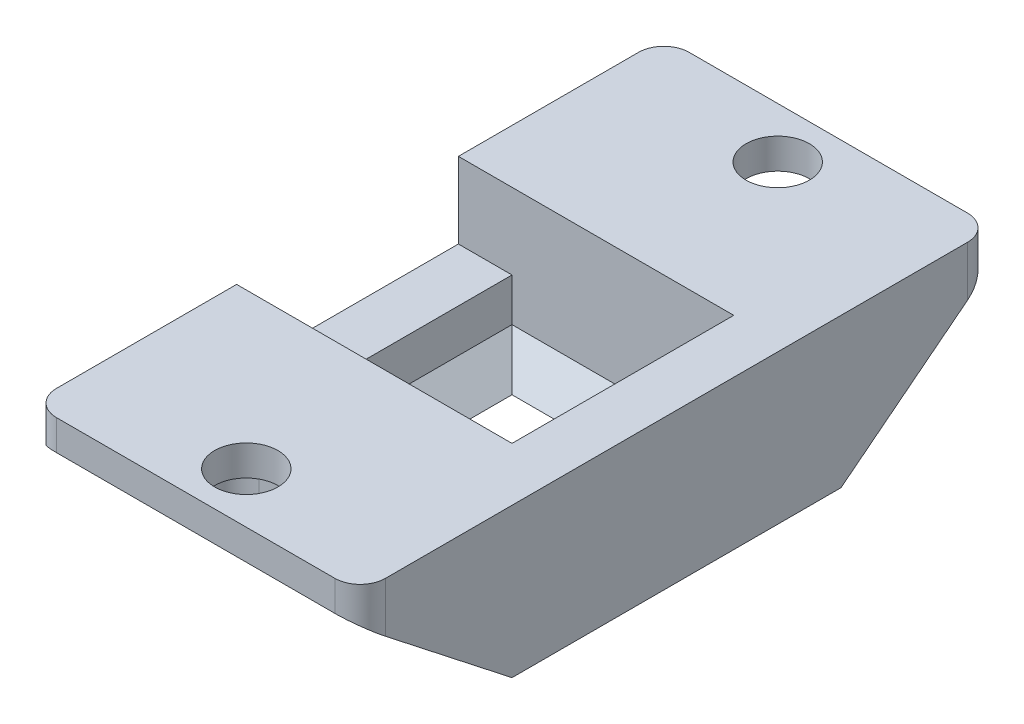
from build123d import *

# Parameters (mm, degrees)
SKETCH1_W           = 8.763
SKETCH1_H           = 8.763
SKETCH1_W_2         = 5.763
SKETCH1_H_2         = 5.763
BOSS_EXTRUDE1_DEPTH = 1.2
SKETCH2_W           = 13
SKETCH2_H           = 13
SKETCH2_W_2         = 8.763
SKETCH2_H_2         = 8.763
BOSS_EXTRUDE3_DEPTH = 5.9
CHAMFER1_SIZE       = 1.5
SKETCH3_W           = 13
SKETCH3_H           = 6
SKETCH3_R           = 1.25
BOSS_EXTRUDE4_DEPTH = 1.2
BOSS_EXTRUDE5_DEPTH = 2
FILLET1_R           = 1
CUT_EXTRUDE1_REACH  = 20.975
SKETCH4_W           = 8.763
SKETCH4_H           = 3


with BuildPart() as part:
    # Sketch1 → Boss-Extrude1 (new body)
    with BuildSketch(Plane(origin=(0, 0, 0), x_dir=(1, 0, 0), z_dir=(0, 1, 0))):
        Rectangle(SKETCH1_W, SKETCH1_H)
        Rectangle(SKETCH1_W_2, SKETCH1_H_2, mode=Mode.SUBTRACT)
    extrude(amount=BOSS_EXTRUDE1_DEPTH)

    # Sketch2 → Boss-Extrude3 (add)
    with BuildSketch(Plane.XZ):
        Rectangle(SKETCH2_W, SKETCH2_H)
        Rectangle(SKETCH2_W_2, SKETCH2_H_2, mode=Mode.SUBTRACT)
    extrude(amount=-BOSS_EXTRUDE3_DEPTH)

    # Chamfer1
    # the kernel refuses this chamfer: 1.5 mm, written as the material it takes off along each edge
    with BuildSketch(Plane(origin=(2.8815, 1.2, -2.8815), x_dir=(0, 0.02749587661058634, -0.9996219169112968), z_dir=(-1, 0, 0))) as chamfer1_piece_1_section:
        Polygon((CHAMFER1_SIZE * 0.999621916911, CHAMFER1_SIZE * 0.0274958766106), (-CHAMFER1_SIZE * 0.0274958766106, CHAMFER1_SIZE * 0.999621916911), (0, 0), align=None)
    chamfer1_piece_1 = extrude(amount=5.763, mode=Mode.PRIVATE)
    chamfer1_piece_1 = split(chamfer1_piece_1, bisect_by=Plane(origin=(0, 0.704393769, -4.3815), z_dir=(0, 0, 1)), keep=Keep.TOP, mode=Mode.PRIVATE)
    add(chamfer1_piece_1, mode=Mode.SUBTRACT)
    with BuildSketch(Plane(origin=(2.8815, 1.2, 2.8815), x_dir=(-0.02749587661058649, -0.9996219169112968, 0), z_dir=(0, 0, -1))) as chamfer1_piece_2_section:
        Polygon((CHAMFER1_SIZE * 0.999621916911, -CHAMFER1_SIZE * 0.0274958766106), (-CHAMFER1_SIZE * 0.0274958766106, -CHAMFER1_SIZE * 0.999621916911), (0, 0), align=None)
    chamfer1_piece_2 = extrude(amount=5.763, mode=Mode.PRIVATE)
    chamfer1_piece_2 = split(chamfer1_piece_2, bisect_by=Plane(origin=(4.3815, 0.704393769, 0), z_dir=(-1, 0, 0)), keep=Keep.TOP, mode=Mode.PRIVATE)
    add(chamfer1_piece_2, mode=Mode.SUBTRACT)
    with BuildSketch(Plane(origin=(-2.8815, 1.2, 2.8815), x_dir=(0, -0.9996219169112968, -0.02749587661058649), z_dir=(1, 0, 0))) as chamfer1_piece_3_section:
        Polygon((CHAMFER1_SIZE * 0.999621916911, -CHAMFER1_SIZE * 0.0274958766106), (-CHAMFER1_SIZE * 0.0274958766106, -CHAMFER1_SIZE * 0.999621916911), (0, 0), align=None)
    chamfer1_piece_3 = extrude(amount=5.763, mode=Mode.PRIVATE)
    chamfer1_piece_3 = split(chamfer1_piece_3, bisect_by=Plane(origin=(0, 0.704393769, 4.3815), z_dir=(0, 0, -1)), keep=Keep.TOP, mode=Mode.PRIVATE)
    add(chamfer1_piece_3, mode=Mode.SUBTRACT)
    with BuildSketch(Plane(origin=(-2.8815, 1.2, -2.8815), x_dir=(0.02749587661058649, -0.9996219169112968, 0), z_dir=(0, 0, 1))) as chamfer1_piece_4_section:
        Polygon((CHAMFER1_SIZE * 0.999621916911, -CHAMFER1_SIZE * 0.0274958766106), (-CHAMFER1_SIZE * 0.0274958766106, -CHAMFER1_SIZE * 0.999621916911), (0, 0), align=None)
    chamfer1_piece_4 = extrude(amount=5.763, mode=Mode.PRIVATE)
    chamfer1_piece_4 = split(chamfer1_piece_4, bisect_by=Plane(origin=(-4.3815, 0.704393769, 0), z_dir=(1, 0, 0)), keep=Keep.TOP, mode=Mode.PRIVATE)
    add(chamfer1_piece_4, mode=Mode.SUBTRACT)
    with BuildSketch(Plane(origin=(2.8815, 1.2, 2.8815), x_dir=(-0.02749587661058649, -0.9996219169112968, 0), z_dir=(0, 0, -1))) as chamfer1_piece_5a_section:
        Polygon((CHAMFER1_SIZE * 0.999621916911, -CHAMFER1_SIZE * 0.0274958766106), (-CHAMFER1_SIZE * 0.0274958766106, -CHAMFER1_SIZE * 0.999621916911), (0, 0), align=None)
    chamfer1_piece_5a = extrude(amount=9.620524482, mode=Mode.PRIVATE)
    chamfer1_piece_5a = split(chamfer1_piece_5a, bisect_by=Plane(origin=(3.374451501, 0.704393769, -2.8815), z_dir=(0, 0, -1)), keep=Keep.TOP, mode=Mode.PRIVATE)
    chamfer1_piece_5a = split(chamfer1_piece_5a, bisect_by=Plane(origin=(3.374451501, 0.704393769, -4.3815), z_dir=(0, 0, 1)), keep=Keep.TOP, mode=Mode.PRIVATE)
    chamfer1_piece_5a = split(chamfer1_piece_5a, bisect_by=Plane(origin=(4.3815, 0.704393769, -3.6315), z_dir=(-1, 0, 0)), keep=Keep.TOP, mode=Mode.PRIVATE)
    with BuildSketch(Plane(origin=(6.739024482, 1.2, -2.8815), x_dir=(0, 0.02749587661058634, -0.9996219169112968), z_dir=(-1, 0, 0))) as chamfer1_piece_5b_section:
        Polygon((CHAMFER1_SIZE * 0.999621916911, CHAMFER1_SIZE * 0.0274958766106), (-CHAMFER1_SIZE * 0.0274958766106, CHAMFER1_SIZE * 0.999621916911), (0, 0), align=None)
    chamfer1_piece_5b = extrude(amount=9.620524482, mode=Mode.PRIVATE)
    chamfer1_piece_5b = split(chamfer1_piece_5b, bisect_by=Plane(origin=(2.8815, 0.704393769, -3.374451501), z_dir=(1, 0, 0)), keep=Keep.TOP, mode=Mode.PRIVATE)
    chamfer1_piece_5b = split(chamfer1_piece_5b, bisect_by=Plane(origin=(3.6315, 0.704393769, -4.3815), z_dir=(0, 0, 1)), keep=Keep.TOP, mode=Mode.PRIVATE)
    chamfer1_piece_5b = split(chamfer1_piece_5b, bisect_by=Plane(origin=(4.3815, 0.704393769, -3.374451501), z_dir=(-1, 0, 0)), keep=Keep.TOP, mode=Mode.PRIVATE)
    chamfer1_piece_5 = chamfer1_piece_5a & chamfer1_piece_5b
    add(chamfer1_piece_5, mode=Mode.SUBTRACT)
    with BuildSketch(Plane(origin=(-2.8815, 1.2, -6.739024482), x_dir=(0.02749587661058649, -0.9996219169112968, 0), z_dir=(0, 0, 1))) as chamfer1_piece_6a_section:
        Polygon((CHAMFER1_SIZE * 0.999621916911, -CHAMFER1_SIZE * 0.0274958766106), (-CHAMFER1_SIZE * 0.0274958766106, -CHAMFER1_SIZE * 0.999621916911), (0, 0), align=None)
    chamfer1_piece_6a = extrude(amount=9.620524482, mode=Mode.PRIVATE)
    chamfer1_piece_6a = split(chamfer1_piece_6a, bisect_by=Plane(origin=(-3.374451501, 0.704393769, -2.8815), z_dir=(0, 0, -1)), keep=Keep.TOP, mode=Mode.PRIVATE)
    chamfer1_piece_6a = split(chamfer1_piece_6a, bisect_by=Plane(origin=(-3.374451501, 0.704393769, -4.3815), z_dir=(0, 0, 1)), keep=Keep.TOP, mode=Mode.PRIVATE)
    chamfer1_piece_6a = split(chamfer1_piece_6a, bisect_by=Plane(origin=(-4.3815, 0.704393769, -3.6315), z_dir=(1, 0, 0)), keep=Keep.TOP, mode=Mode.PRIVATE)
    with BuildSketch(Plane(origin=(2.8815, 1.2, -2.8815), x_dir=(0, 0.02749587661058634, -0.9996219169112968), z_dir=(-1, 0, 0))) as chamfer1_piece_6b_section:
        Polygon((CHAMFER1_SIZE * 0.999621916911, CHAMFER1_SIZE * 0.0274958766106), (-CHAMFER1_SIZE * 0.0274958766106, CHAMFER1_SIZE * 0.999621916911), (0, 0), align=None)
    chamfer1_piece_6b = extrude(amount=9.620524482, mode=Mode.PRIVATE)
    chamfer1_piece_6b = split(chamfer1_piece_6b, bisect_by=Plane(origin=(-2.8815, 0.704393769, -3.374451501), z_dir=(-1, 0, 0)), keep=Keep.TOP, mode=Mode.PRIVATE)
    chamfer1_piece_6b = split(chamfer1_piece_6b, bisect_by=Plane(origin=(-3.6315, 0.704393769, -4.3815), z_dir=(0, 0, 1)), keep=Keep.TOP, mode=Mode.PRIVATE)
    chamfer1_piece_6b = split(chamfer1_piece_6b, bisect_by=Plane(origin=(-4.3815, 0.704393769, -3.374451501), z_dir=(1, 0, 0)), keep=Keep.TOP, mode=Mode.PRIVATE)
    chamfer1_piece_6 = chamfer1_piece_6a & chamfer1_piece_6b
    add(chamfer1_piece_6, mode=Mode.SUBTRACT)
    with BuildSketch(Plane(origin=(-2.8815, 1.2, 2.8815), x_dir=(0, -0.9996219169112968, -0.02749587661058649), z_dir=(1, 0, 0))) as chamfer1_piece_7a_section:
        Polygon((CHAMFER1_SIZE * 0.999621916911, -CHAMFER1_SIZE * 0.0274958766106), (-CHAMFER1_SIZE * 0.0274958766106, -CHAMFER1_SIZE * 0.999621916911), (0, 0), align=None)
    chamfer1_piece_7a = extrude(amount=9.620524482, mode=Mode.PRIVATE)
    chamfer1_piece_7a = split(chamfer1_piece_7a, bisect_by=Plane(origin=(2.8815, 0.704393769, 3.374451501), z_dir=(1, 0, 0)), keep=Keep.TOP, mode=Mode.PRIVATE)
    chamfer1_piece_7a = split(chamfer1_piece_7a, bisect_by=Plane(origin=(4.3815, 0.704393769, 3.374451501), z_dir=(-1, 0, 0)), keep=Keep.TOP, mode=Mode.PRIVATE)
    chamfer1_piece_7a = split(chamfer1_piece_7a, bisect_by=Plane(origin=(3.6315, 0.704393769, 4.3815), z_dir=(0, 0, -1)), keep=Keep.TOP, mode=Mode.PRIVATE)
    with BuildSketch(Plane(origin=(2.8815, 1.2, 6.739024482), x_dir=(-0.02749587661058649, -0.9996219169112968, 0), z_dir=(0, 0, -1))) as chamfer1_piece_7b_section:
        Polygon((CHAMFER1_SIZE * 0.999621916911, -CHAMFER1_SIZE * 0.0274958766106), (-CHAMFER1_SIZE * 0.0274958766106, -CHAMFER1_SIZE * 0.999621916911), (0, 0), align=None)
    chamfer1_piece_7b = extrude(amount=9.620524482, mode=Mode.PRIVATE)
    chamfer1_piece_7b = split(chamfer1_piece_7b, bisect_by=Plane(origin=(3.374451501, 0.704393769, 2.8815), z_dir=(0, 0, 1)), keep=Keep.TOP, mode=Mode.PRIVATE)
    chamfer1_piece_7b = split(chamfer1_piece_7b, bisect_by=Plane(origin=(4.3815, 0.704393769, 3.6315), z_dir=(-1, 0, 0)), keep=Keep.TOP, mode=Mode.PRIVATE)
    chamfer1_piece_7b = split(chamfer1_piece_7b, bisect_by=Plane(origin=(3.374451501, 0.704393769, 4.3815), z_dir=(0, 0, -1)), keep=Keep.TOP, mode=Mode.PRIVATE)
    chamfer1_piece_7 = chamfer1_piece_7a & chamfer1_piece_7b
    add(chamfer1_piece_7, mode=Mode.SUBTRACT)
    with BuildSketch(Plane(origin=(-6.739024482, 1.2, 2.8815), x_dir=(0, -0.9996219169112968, -0.02749587661058649), z_dir=(1, 0, 0))) as chamfer1_piece_8a_section:
        Polygon((CHAMFER1_SIZE * 0.999621916911, -CHAMFER1_SIZE * 0.0274958766106), (-CHAMFER1_SIZE * 0.0274958766106, -CHAMFER1_SIZE * 0.999621916911), (0, 0), align=None)
    chamfer1_piece_8a = extrude(amount=9.620524482, mode=Mode.PRIVATE)
    chamfer1_piece_8a = split(chamfer1_piece_8a, bisect_by=Plane(origin=(-2.8815, 0.704393769, 3.374451501), z_dir=(-1, 0, 0)), keep=Keep.TOP, mode=Mode.PRIVATE)
    chamfer1_piece_8a = split(chamfer1_piece_8a, bisect_by=Plane(origin=(-3.6315, 0.704393769, 4.3815), z_dir=(0, 0, -1)), keep=Keep.TOP, mode=Mode.PRIVATE)
    chamfer1_piece_8a = split(chamfer1_piece_8a, bisect_by=Plane(origin=(-4.3815, 0.704393769, 3.374451501), z_dir=(1, 0, 0)), keep=Keep.TOP, mode=Mode.PRIVATE)
    with BuildSketch(Plane(origin=(-2.8815, 1.2, -2.8815), x_dir=(0.02749587661058649, -0.9996219169112968, 0), z_dir=(0, 0, 1))) as chamfer1_piece_8b_section:
        Polygon((CHAMFER1_SIZE * 0.999621916911, -CHAMFER1_SIZE * 0.0274958766106), (-CHAMFER1_SIZE * 0.0274958766106, -CHAMFER1_SIZE * 0.999621916911), (0, 0), align=None)
    chamfer1_piece_8b = extrude(amount=9.620524482, mode=Mode.PRIVATE)
    chamfer1_piece_8b = split(chamfer1_piece_8b, bisect_by=Plane(origin=(-3.374451501, 0.704393769, 2.8815), z_dir=(0, 0, 1)), keep=Keep.TOP, mode=Mode.PRIVATE)
    chamfer1_piece_8b = split(chamfer1_piece_8b, bisect_by=Plane(origin=(-3.374451501, 0.704393769, 4.3815), z_dir=(0, 0, -1)), keep=Keep.TOP, mode=Mode.PRIVATE)
    chamfer1_piece_8b = split(chamfer1_piece_8b, bisect_by=Plane(origin=(-4.3815, 0.704393769, 3.6315), z_dir=(1, 0, 0)), keep=Keep.TOP, mode=Mode.PRIVATE)
    chamfer1_piece_8 = chamfer1_piece_8a & chamfer1_piece_8b
    add(chamfer1_piece_8, mode=Mode.SUBTRACT)

    # Sketch3 → Boss-Extrude4 (add)
    with BuildSketch(Plane(origin=(0, 5.9, 0), x_dir=(1, 0, 0), z_dir=(0, 1, 0))):
        with Locations((0, 9.5)):
            Rectangle(SKETCH3_W, SKETCH3_H)
        with Locations(Location((0, 10.5, 0), (0, 0, 270))):
            Circle(SKETCH3_R, mode=Mode.SUBTRACT)
    boss_extrude4 = extrude(amount=-BOSS_EXTRUDE4_DEPTH)

    # Mirror1: Boss-Extrude4 across plane
    add(boss_extrude4.mirror(Plane.XY))

    # Sketch5 → Boss-Extrude5 (add)
    with BuildSketch(Plane.ZY.offset(6.5)):
        Polygon((6.5, 4.7), (6.5, 0), (12.5, 4.7), align=None)
        Polygon((-6.5, 4.7), (-6.5, 0), (-12.5, 4.7), align=None)
    boss_extrude5 = extrude(amount=-BOSS_EXTRUDE5_DEPTH)

    # Mirror2: Boss-Extrude5 across plane
    add(boss_extrude5.mirror(Plane(origin=(0, 0, 0), x_dir=(0, 0, 1), z_dir=(1, 0, 0))))

    # Fillet1
    fillet1_edges = [part.edges().sort_by_distance(p)[0] for p in [
        (-4.5, 2.35, -6.5),
        (4.5, 2.35, 6.5),
        (4.5, 2.35, -6.5),
        (-6.5, 5.3, -12.5),
        (6.5, 5.3, -12.5),
        (-6.5, 5.3, 12.5),
        (6.5, 5.3, 12.5),
        (-4.5, 2.35, 6.5),
    ]]
    fillet(fillet1_edges, radius=FILLET1_R)

    # Sketch4 → Cut-Extrude1 (cut, up to next)
    with BuildSketch(Plane.ZY.offset(6.5), mode=Mode.PRIVATE) as cut_extrude1_sk1:
        with Locations((0, 4.4)):
            Rectangle(SKETCH4_W, SKETCH4_H)
    cut_extrude1_tool1 = extrude(cut_extrude1_sk1.sketch, amount=-CUT_EXTRUDE1_REACH, mode=Mode.PRIVATE) & part.part
    add(cut_extrude1_tool1.solids().sort_by_distance((-6.5, 4.4, 0))[0], mode=Mode.SUBTRACT)


solid = part.part
